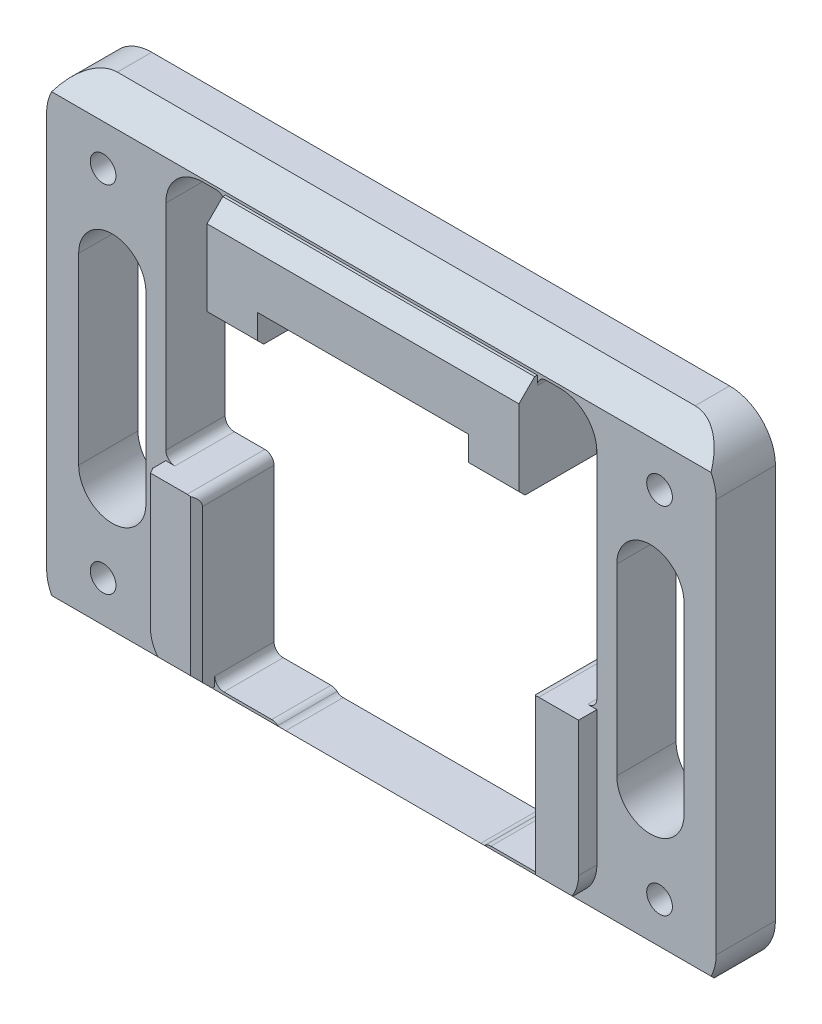
from build123d import *

# Parameters (mm, degrees)
SKETCH1_W                   = 79.5
SKETCH1_H                   = 79.5
SKETCH1_W_2                 = 54.5
SKETCH1_H_2                 = 54.5
BOSS_EXTRUDE1_DEPTH         = 12.7
CHAMFER2_SIZE               = 4
SKETCH2_W                   = 34.5
SKETCH2_H                   = 5
SKETCH2_H_2                 = 0.75
CUT_EXTRUDE1_DEPTH          = 64.41462765
BOSS_EXTRUDE2_DEPTH         = 12.7
CUT_EXTRUDE2_DEPTH          = 3
CUT_EXTRUDE3_DEPTH          = 121.131604917
CHAMFER5_SIZE               = 0.5
CHAMFER5_SIZE2              = 0.866025404
TAP_DRILL_FOR_M5X0_8_TAP3_D = 4.2
CUT_EXTRUDE4_DEPTH          = 74.291984555
FILLET1_R                   = 1.5
FILLET2_R                   = 1.5
FILLET3_R                   = 1.5
CHAMFER4_SIZE               = 1


with BuildPart() as part:
    # Sketch1 → Boss-Extrude1 (new body)
    with BuildSketch(Plane.XY):
        with Locations((0, 8)):
            Rectangle(SKETCH1_W, SKETCH1_H)
        Rectangle(SKETCH1_W_2, SKETCH1_H_2, mode=Mode.SUBTRACT)
    extrude(amount=BOSS_EXTRUDE1_DEPTH)

    # Chamfer2
    chamfer2_edges = [part.edges().sort_by_distance(p)[0] for p in [
        (39.75, -31.75, 6.35),
        (-39.75, -31.75, 6.35),
        (-39.75, 47.75, 6.35),
        (39.75, 47.75, 6.35),
    ]]
    chamfer(chamfer2_edges, length=CHAMFER2_SIZE)

    # Sketch2 → Cut-Extrude1 (cut, through all)
    with BuildSketch(Plane.XY.offset(12.7)):
        with BuildLine():
            Line((-27.25, 27.25), (-25.5, 27.25))
            Line((-25.5, 27.25), (-25.5, 43.25))
            Line((-25.5, 43.25), (-29.25, 43.25))
            ThreePointArc((-29.25, 43.25), (-33.492640687, 41.492640687), (-35.25, 37.25))
            Line((-35.25, 37.25), (-35.25, 0.75))
            Line((-35.25, 0.75), (-27.25, 0.75))
            Line((-27.25, 0.75), (-27.25, 27.25))
        make_face()
        with Locations((0, 29.75)):
            Rectangle(SKETCH2_W, SKETCH2_H)
        with BuildLine():
            Line((25.5, 43.25), (25.5, 27.25))
            Line((25.5, 27.25), (27.25, 27.25))
            Line((27.25, 27.25), (27.25, 0.75))
            Line((27.25, 0.75), (35.25, 0.75))
            Line((35.25, 0.75), (35.25, 37.25))
            ThreePointArc((35.25, 37.25), (33.492640687, 41.492640687), (29.25, 43.25))
            Line((29.25, 43.25), (25.5, 43.25))
        make_face()
        with Locations((0, -27.625)):
            Rectangle(SKETCH2_W, SKETCH2_H_2)
    extrude(amount=-CUT_EXTRUDE1_DEPTH, mode=Mode.SUBTRACT)

    # Sketch5 → Boss-Extrude2 (add)
    with BuildSketch(Plane.XY.offset(12.7)):
        with BuildLine():
            Line((-47.25, -31.75), (-35.75, -31.75))
            Line((-35.75, -31.75), (-39.75, -27.75))
            Line((-39.75, -27.75), (-39.75, 43.75))
            Line((-39.75, 43.75), (-35.75, 47.75))
            Line((-35.75, 47.75), (-47.25, 47.75))
            ThreePointArc((-47.25, 47.75), (-52.553300859, 45.553300859), (-54.75, 40.25))
            Line((-54.75, 40.25), (-54.75, -24.25))
            ThreePointArc((-54.75, -24.25), (-52.553300859, -29.553300859), (-47.25, -31.75))
        make_face()
        with BuildLine():
            Line((35.75, -31.75), (47.25, -31.75))
            ThreePointArc((47.25, -31.75), (52.553300859, -29.553300859), (54.75, -24.25))
            Line((54.75, -24.25), (54.75, 40.25))
            ThreePointArc((54.75, 40.25), (52.553300859, 45.553300859), (47.25, 47.75))
            Line((47.25, 47.75), (35.75, 47.75))
            Line((35.75, 47.75), (39.75, 43.75))
            Line((39.75, 43.75), (39.75, -27.75))
            Line((39.75, -27.75), (35.75, -31.75))
        make_face()
    extrude(amount=-BOSS_EXTRUDE2_DEPTH)

    # Sketch7 → Cut-Extrude2 (cut)
    with BuildSketch(Plane.XY.offset(12.7)):
        with BuildLine():
            ThreePointArc((54.75, 40.25), (52.553300859, 45.553300859), (47.25, 47.75))
            Line((47.25, 47.75), (-47.25, 47.75))
            ThreePointArc((-47.25, 47.75), (-52.553300859, 45.553300859), (-54.75, 40.25))
            Line((-54.75, 40.25), (-54.75, -24.25))
            ThreePointArc((-54.75, -24.25), (-52.553300859, -29.553300859), (-47.25, -31.75))
            Line((-47.25, -31.75), (47.25, -31.75))
            ThreePointArc((47.25, -31.75), (52.553300859, -29.553300859), (54.75, -24.25))
            Line((54.75, -24.25), (54.75, 40.25))
        make_face()
        with BuildLine():
            ThreePointArc((35.25, -21.25), (33.492640687, -25.492640687), (29.25, -27.25))
            Line((29.25, -27.25), (27.25, -27.25))
            Line((27.25, -27.25), (17.25, -27.25))
            Line((17.25, -27.25), (17.25, -28))
            Line((17.25, -28), (-17.25, -28))
            Line((-17.25, -28), (-17.25, -27.25))
            Line((-17.25, -27.25), (-27.25, -27.25))
            Line((-27.25, -27.25), (-29.25, -27.25))
            ThreePointArc((-29.25, -27.25), (-33.492640687, -25.492640687), (-35.25, -21.25))
            Line((-35.25, -21.25), (-35.25, 0.75))
            Line((-35.25, 0.75), (-35.25, 37.25))
            ThreePointArc((-35.25, 37.25), (-33.492640687, 41.492640687), (-29.25, 43.25))
            Line((-29.25, 43.25), (-25.5, 43.25))
            Line((-25.5, 43.25), (25.5, 43.25))
            Line((25.5, 43.25), (29.25, 43.25))
            ThreePointArc((29.25, 43.25), (33.492640687, 41.492640687), (35.25, 37.25))
            Line((35.25, 37.25), (35.25, 0.75))
            Line((35.25, 0.75), (35.25, -21.25))
        make_face(mode=Mode.SUBTRACT)
    extrude(amount=-CUT_EXTRUDE2_DEPTH, mode=Mode.SUBTRACT)

    # Sketch8 → Cut-Extrude3 (cut, through all)
    with BuildSketch(Plane.ZY.offset(54.75)):
        Polygon((5.628932188, -31.75), (12.7, -24.678932188), (12.7, -31.75), align=None)
        Polygon((12.7, 47.75), (5.628932188, 47.75), (12.7, 40.678932188), align=None)
    extrude(amount=-CUT_EXTRUDE3_DEPTH, mode=Mode.SUBTRACT)

    # Chamfer5
    chamfer5_edges = [part.edges().sort_by_distance(p)[0] for p in [
        (-35.25, -10.25, 12.7),
        (-34.974594209, -23.046947729, 12.7),
    ]]
    chamfer5_side = [part.faces().sort_by_distance(p)[0] for p in [
        (-31.22846957, -11.895050932, 12.7),
    ]]
    chamfer(chamfer5_edges, length=CHAMFER5_SIZE, length2=CHAMFER5_SIZE2, reference=chamfer5_side[0])

    # Tap Drill for M5x0.8 Tap3 (through all)
    with Locations(Plane.XY.offset(9.7)):
        with Locations((-45.5, 37), (-45.5, -21), (45.5, -21), (45.5, 37)):
            Hole(TAP_DRILL_FOR_M5X0_8_TAP3_D / 2)

    # Sketch11 → Cut-Extrude4 (cut, through all)
    with BuildSketch(Plane.XY.offset(9.7)):
        with BuildLine():
            Line((-38.5, 23), (-38.5, -7))
            ThreePointArc((-38.5, -7), (-44, -12.5), (-49.5, -7))
            Line((-49.5, -7), (-49.5, 23))
            ThreePointArc((-49.5, 23), (-44, 28.5), (-38.5, 23))
        make_face()
        with BuildLine():
            Line((38.5, 23), (38.5, -7))
            ThreePointArc((38.5, -7), (44, -12.5), (49.5, -7))
            Line((49.5, -7), (49.5, 23))
            ThreePointArc((49.5, 23), (44, 28.5), (38.5, 23))
        make_face()
    extrude(amount=-CUT_EXTRUDE4_DEPTH, mode=Mode.SUBTRACT)

    # Fillet1
    fillet1_edges = [part.edges().sort_by_distance(p)[0] for p in [
        (-27.25, -27.25, 4.85),
        (27.25, -27.25, 4.85),
        (-25.5, 43.25, 4.85),
        (-27.25, 0.75, 6.35),
        (-35.25, 0.75, 4.85),
        (35.25, 0.75, 4.85),
        (27.25, 0.75, 6.35),
        (25.5, 43.25, 4.85),
    ]]
    fillet(fillet1_edges, radius=FILLET1_R)

    # Fillet2
    # the kernel refuses this fillet: 1.5 mm, written as the material it adds along each edge
    with BuildSketch(Plane(origin=(17.25, -28, 12.626527452), x_dir=(0, 1, 0), z_dir=(0, 0, -1))) as fillet2_piece_1_section:
        with BuildLine():
            CenterArc((1.5, -1.299038106), FILLET2_R, 120, 60)
            Line((0, -1.299038106), (-0.03, -1.299038106))
            Line((-0.03, -1.299038106), (-0.03, 0))
            Line((-0.03, 0), (0, 0.03))
            ThreePointArc((0, 0.03), (0.375, 0.03), (0.735, 0.025980762))
            Line((0.735, 0.025980762), (0.75, 0))
        make_face()
    fillet2_piece_1 = extrude(amount=12.626527452, mode=Mode.PRIVATE)
    fillet2_piece_1 = split(fillet2_piece_1, bisect_by=Plane(origin=(16.927844244, -27.803524046, 9.7), z_dir=(0, 0, -1)), keep=Keep.TOP, mode=Mode.PRIVATE)
    fillet2_piece_1 = split(fillet2_piece_1, bisect_by=Plane(origin=(16.927844244, -30.206033858, 7.17289833), z_dir=(0, 0.7071067811865475, -0.7071067811865477)), keep=Keep.TOP, mode=Mode.PRIVATE)
    add(fillet2_piece_1)
    with BuildSketch(Plane(origin=(-17.25, -28, 12.626527452), x_dir=(1, 0, 0), z_dir=(0, 0, -1))) as fillet2_piece_2_section:
        with BuildLine():
            CenterArc((1.299038106, -1.5), FILLET2_R, 90, 60)
            Line((0, -0.75), (-0.025980762, -0.735))
            ThreePointArc((-0.025980762, -0.735), (-0.03, -0.375), (-0.03, 0))
            Line((-0.03, 0), (0, 0.03))
            Line((0, 0.03), (1.299038106, 0.03))
            Line((1.299038106, 0.03), (1.299038106, 0))
        make_face()
    fillet2_piece_2 = extrude(amount=12.626527452, mode=Mode.PRIVATE)
    fillet2_piece_2 = split(fillet2_piece_2, bisect_by=Plane(origin=(-16.927844244, -27.803524046, 9.7), z_dir=(0, 0, -1)), keep=Keep.TOP, mode=Mode.PRIVATE)
    fillet2_piece_2 = split(fillet2_piece_2, bisect_by=Plane(origin=(-16.927844244, -30.206033859, 7.172898329), z_dir=(0, 0.7071067811865475, -0.7071067811865477)), keep=Keep.TOP, mode=Mode.PRIVATE)
    add(fillet2_piece_2)

    # Fillet3
    fillet3_edges = [part.edges().sort_by_distance(p)[0] for p in [
        (-17.25, -27.25, 4.85),
        (17.25, -27.25, 4.85),
    ]]
    fillet(fillet3_edges, radius=FILLET3_R)

    # Chamfer4
    # the kernel refuses this chamfer: 1 mm, written as the material it takes off along each edge
    with BuildSketch(Plane(origin=(-27.25, -27.250615176, 12.7), x_dir=(0.027495876610585647, 0, -0.9996219169112968), z_dir=(0, 1, 0)), Plane(origin=(27.25, 1.821682988, 12.7), x_dir=(-0.027495876610585647, 0, -0.9996219169112968), z_dir=(0, -1, 0))) as chamfer4_piece_1:
        Polygon((CHAMFER4_SIZE * 0.999621916911, CHAMFER4_SIZE * 0.0274958766106), (-CHAMFER4_SIZE * 0.0274958766106, CHAMFER4_SIZE * 0.999621916911), (0, 0), align=None)
    extrude(amount=29.072298164, mode=Mode.SUBTRACT)
    with BuildSketch(Plane(origin=(-28.071682988, 27.25, 12.7), x_dir=(0, -0.027495876610585647, -0.9996219169112968), z_dir=(1, 0, 0))) as chamfer4_piece_2:
        Polygon((CHAMFER4_SIZE * 0.999621916911, CHAMFER4_SIZE * 0.0274958766106), (-CHAMFER4_SIZE * 0.0274958766106, CHAMFER4_SIZE * 0.999621916911), (0, 0), align=None)
    extrude(amount=13.393365976, mode=Mode.SUBTRACT)
    with BuildSketch(Plane(origin=(14.678317012, 27.25, 12.7), x_dir=(0, 0.9996219169112968, 0.027495876610585647), z_dir=(1, 0, 0))) as chamfer4_piece_3:
        Polygon((CHAMFER4_SIZE * 0.999621916911, -CHAMFER4_SIZE * 0.0274958766106), (-CHAMFER4_SIZE * 0.0274958766106, -CHAMFER4_SIZE * 0.999621916911), (0, 0), align=None)
    extrude(amount=13.393365976, mode=Mode.SUBTRACT)


solid = part.part
